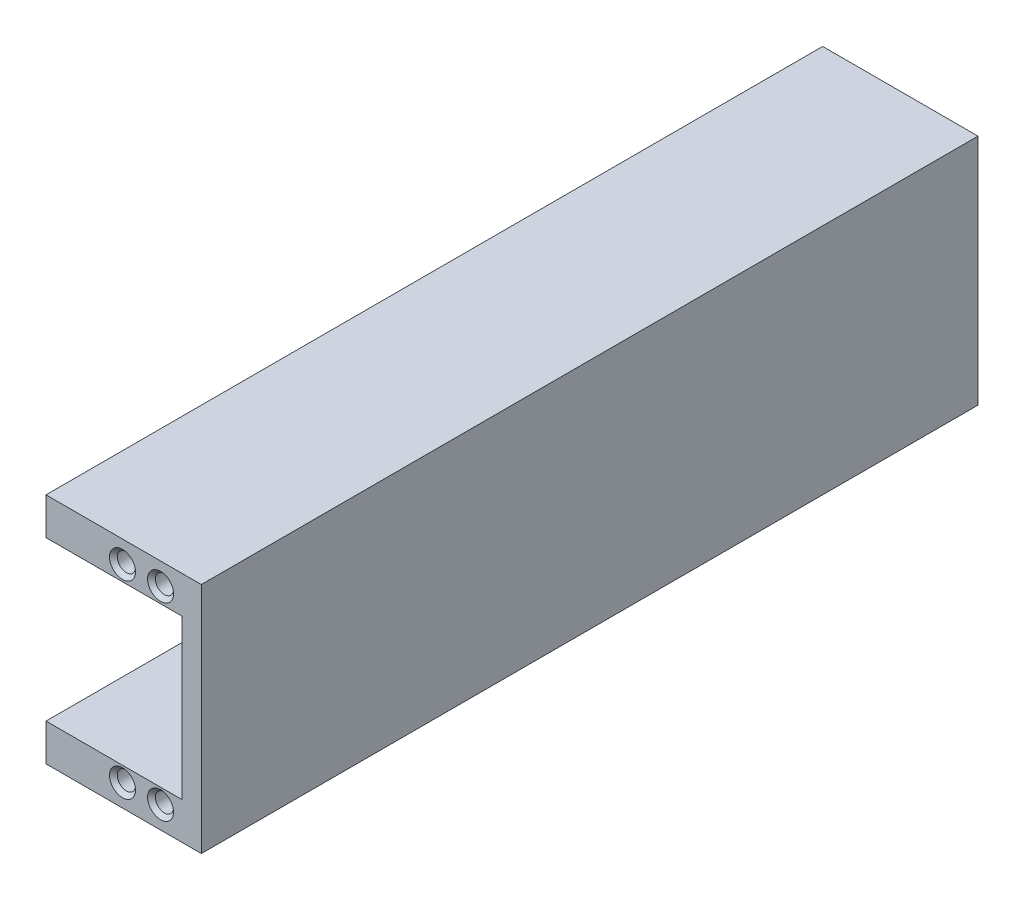
from build123d import *

# Parameters (mm, degrees)
BOSS_EXTRUDE1_DEPTH = 200
SKETCH2_R           = 2.35
CUT_EXTRUDE1_DEPTH  = 8
CUT_EXTRUDE2_START  = -8
SKETCH3_R           = 2.35
CUT_EXTRUDE2_DEPTH  = 8
CHAMFER1_SIZE       = 1


with BuildPart() as part:
    # Sketch1 → Boss-Extrude1 (new body)
    with BuildSketch(Plane.XY):
        Polygon((-20, 30), (20, 30), (20, -30), (-20, -30), (-20, -20.45), (15, -20.45), (15, 20.45), (-20, 20.45), align=None)
    extrude(amount=BOSS_EXTRUDE1_DEPTH)

    # Sketch2 → Cut-Extrude1 (cut)
    with BuildSketch(Plane.XY.offset(200)):
        with Locations((9.5, 24.34)):
            Circle(SKETCH2_R)
        with Locations((-0.3, 24.34)):
            Circle(SKETCH2_R)
        with Locations((-0.3, -24.34)):
            Circle(SKETCH2_R)
        with Locations((9.5, -24.34)):
            Circle(SKETCH2_R)
    extrude(amount=-CUT_EXTRUDE1_DEPTH, mode=Mode.SUBTRACT)

    # Sketch3 → Cut-Extrude2 (cut)
    with BuildSketch(Plane(origin=(0, 0, 0), x_dir=(-1, 0, 0), z_dir=(0, 0, -1)).offset(CUT_EXTRUDE2_START)):
        with Locations((-9.5, 24.34)):
            Circle(SKETCH3_R)
        with Locations((0.3, 24.34)):
            Circle(SKETCH3_R)
        with Locations((0.3, -24.34)):
            Circle(SKETCH3_R)
        with Locations((-9.5, -24.34)):
            Circle(SKETCH3_R)
    extrude(amount=CUT_EXTRUDE2_DEPTH, mode=Mode.SUBTRACT)

    # Chamfer1
    chamfer1_edges = [part.edges().sort_by_distance(p)[0] for p in [
        (2.05, -24.34, 0),
        (11.85, -24.34, 0),
        (11.85, 24.34, 0),
        (2.05, 24.34, 0),
        (7.15, -24.34, 200),
        (-2.65, -24.34, 200),
        (-2.65, 24.34, 200),
        (7.15, 24.34, 200),
    ]]
    chamfer(chamfer1_edges, length=CHAMFER1_SIZE)


solid = part.part
